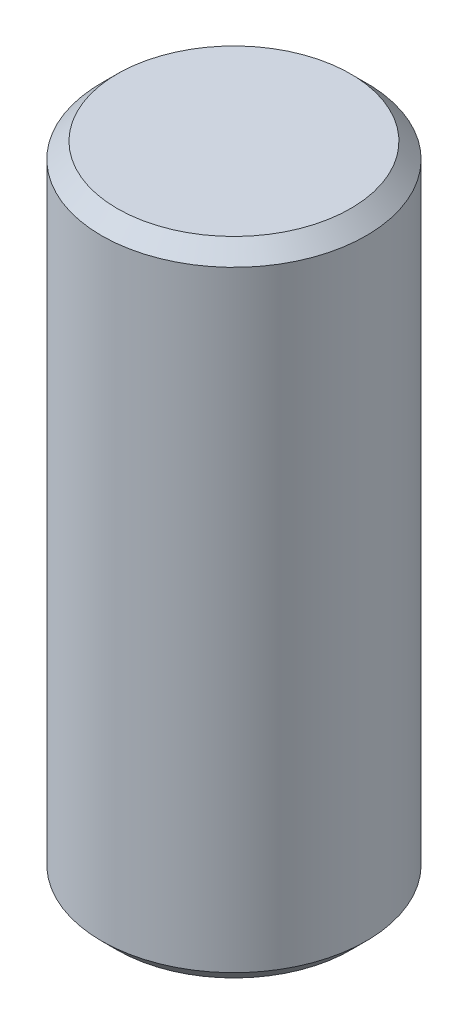
from build123d import *

# Parameters (mm, degrees)
SKETCH1_R           = 16.9
BOSS_EXTRUDE1_DEPTH = 41
FILLET1_SIZE        = 2


with BuildPart() as part:
    # Sketch1 → Boss-Extrude1 (new, symmetric)
    with BuildSketch(Plane(origin=(0, 0, 0), x_dir=(1, 0, 0), z_dir=(0, 1, 0))):
        Circle(SKETCH1_R)
    extrude(amount=BOSS_EXTRUDE1_DEPTH, both=True)

    # Fillet1
    fillet1_edges = [part.edges().sort_by_distance(p)[0] for p in [
        (-16.9, -41, 0),
        (-16.9, 41, 0),
    ]]
    chamfer(fillet1_edges, length=FILLET1_SIZE)


solid = part.part
